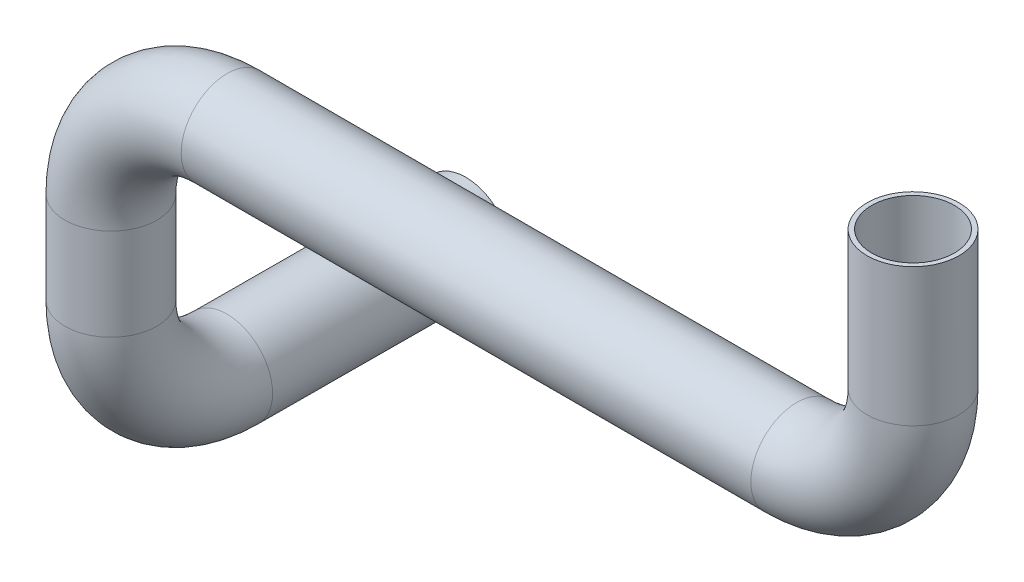
from build123d import *

# Parameters (mm, degrees)
SKETCH1_R          = 5
SWEEP2_START       = -38.65011349
SWEEP2_OUTLINE_R   = 5
SWEEP2_DEPTH       = 26.000221027
SWEEP2_2_OUTLINE_R = 5
SWEEP2_2_ANGLE     = 89.76375
SHELL1_T           = -0.5


with BuildPart() as part:
    # Sweep1: sweep along a path in Sketch2
    with BuildLine(Plane.XY) as sweep1_path:
        Line((0, 0), (0, 10))
        ThreePointArc((0, 10), (3.705099218, 18.944900782), (12.65, 22.65))
        Line((12.65, 22.65), (74.65, 22.65))
        ThreePointArc((74.65, 22.65), (83.594900782, 26.355099218), (87.3, 35.3))
        Line((87.3, 35.3), (87.3, 50.3))
    # Sketch1 → Sweep1 (sweep)
    with BuildSketch(Plane(origin=(0, 0, 0), x_dir=(1, 0, 0), z_dir=(0, 1, 0))):
        Circle(SKETCH1_R)
    sweep(path=sweep1_path.line)



with BuildPart() as body_2:
    # Sweep2: read off the stored shape, not the designer's step
    # Sweep2 outline → Sweep2 (new body)
    with BuildSketch(Plane(origin=(0, 0, 0), x_dir=(1, 0, 0), z_dir=(0, 0.00412333182871543, 0.999991499031182)).offset(SWEEP2_START)):
        with Locations((0, -12.597839852)):
            Circle(SWEEP2_OUTLINE_R)
    extrude(amount=SWEEP2_DEPTH)


with BuildPart() as part_1:
    add(part.part)

    add(body_2.part)  # Sweep2 2 merges body 2
    # Sweep2 2 outline → Sweep2 2 (revolve)
    with BuildSketch(Plane(origin=(0, 0, -12.65), x_dir=(0, 0, 1), z_dir=(0, 1, 0))):
        with Locations((12.65, 0)):
            Circle(SWEEP2_2_OUTLINE_R)
    revolve(axis=Axis((0, 0, -12.65), (1, 0, 0)), revolution_arc=SWEEP2_2_ANGLE)

    # Shell1
    shell1_openings = [part_1.faces().sort_by_distance(p)[0] for p in [
        (0, -12.757100001, -38.597839853),
        (87.3, 50.3, 0),
    ]]
    offset(amount=SHELL1_T, openings=shell1_openings, kind=Kind.INTERSECTION)


solid = part_1.part
